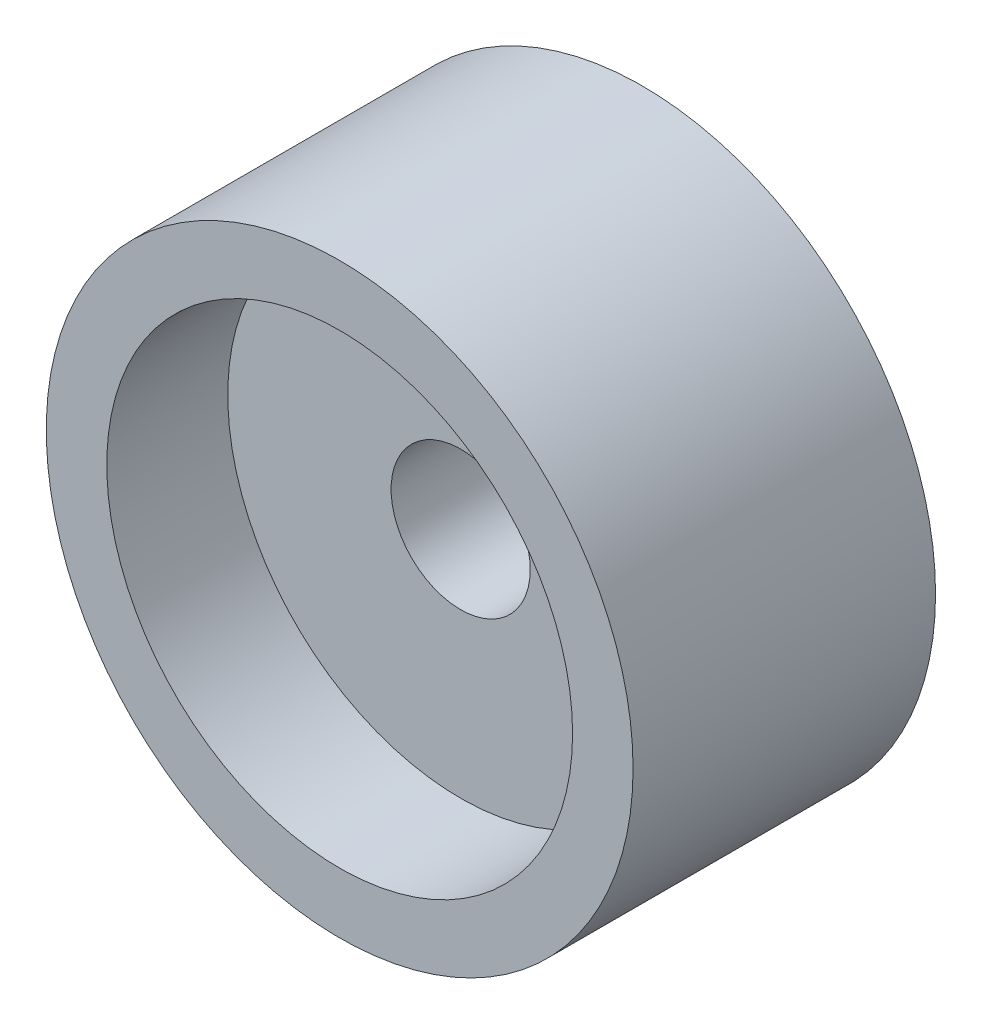
from build123d import *

# Parameters (mm, degrees)
SKETCH1_R           = 4.85
SKETCH1_R_2         = 3.85
BOSS_EXTRUDE1_DEPTH = 2
BOSS_EXTRUDE2_START = -3
SKETCH1_3_R         = 4.85
SKETCH1_3_R_2       = 1.15
BOSS_EXTRUDE2_DEPTH = 3


with BuildPart() as part:
    # Sketch1 → Boss-Extrude1 (new body)
    with BuildSketch(Plane.XY):
        Circle(SKETCH1_R)
        Circle(SKETCH1_R_2, mode=Mode.SUBTRACT)
    extrude(amount=BOSS_EXTRUDE1_DEPTH)

    # Sketch1<3> → Boss-Extrude2 (add)
    with BuildSketch(Plane.XY.offset(BOSS_EXTRUDE2_START)):
        Circle(SKETCH1_3_R)
        Circle(SKETCH1_3_R_2, mode=Mode.SUBTRACT)
    extrude(amount=BOSS_EXTRUDE2_DEPTH)


solid = part.part
